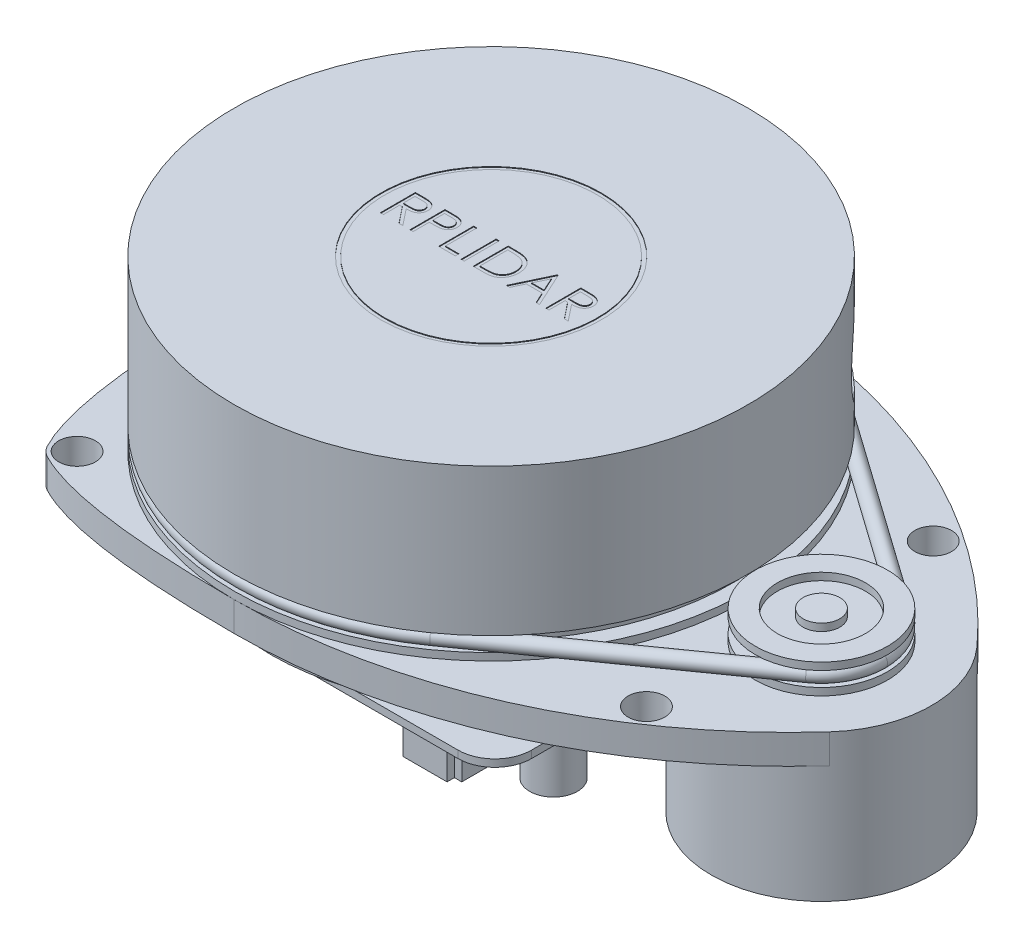
from build123d import *

# Parameters (mm, degrees)
SKETCH2_W            = 0.427404
SKETCH2_H            = 4.7625
CUT_EXTRUDE2_DEPTH   = 0.1
SKETCH4_R            = 1
SKETCH11_R           = 9
BOSS_EXTRUDE2_DEPTH  = 1
SKETCH12_R           = 7
BOSS_EXTRUDE3_DEPTH  = 2
SKETCH13_R           = 9
BOSS_EXTRUDE4_DEPTH  = 1
SKETCH14_R           = 6
SKETCH14_R_2         = 2.5
CUT_EXTRUDE3_DEPTH   = 1
SKETCH15_R           = 4
CUT_EXTRUDE4_DEPTH   = 69.337398
BOSS_EXTRUDE5_DEPTH  = 4
SKETCH18_R           = 15
BOSS_EXTRUDE7_DEPTH  = 16
BOSS_EXTRUDE11_DEPTH = 5
BOSS_EXTRUDE12_DEPTH = 1
FILLET1_R            = 3
SKETCH21_R           = 2.5
CUT_EXTRUDE6_DEPTH   = 10
SKETCH22_W           = 3.5
SKETCH22_H           = 8
SKETCH22_H_2         = 9
SKETCH22_H_3         = 10
BOSS_EXTRUDE13_DEPTH = 6.5
SKETCH23_R           = 3.25
BOSS_EXTRUDE14_DEPTH = 8
BOSS_EXTRUDE15_DEPTH = 4


with BuildPart() as part:
    # Sketch1 → Revolve2 (revolve)
    with BuildSketch(Plane.XY):
        Polygon((0, 0), (-35, 0), (-35, 1), (-33, 1), (-33, 3), (-35, 3), (-35, 23), (-15, 23), (-15, 22.9), (-14.5, 22.9), (-14.5, 23), (0, 23), align=None)
    revolve(axis=Axis((0, 67.529449, 0), (0, -1, 0)))

    # Sketch2 → Cut-Extrude2 (cut)
    # profile 1 of 7: a face of its own
    with BuildSketch(Plane(origin=(0, 23, 0), x_dir=(1, 0, 0), z_dir=(0, 1, 0))):
        with BuildLine():
            Line((-12.69453, 2.38125), (-11.741457, 2.38125))
            add(Edge.make_bspline(
                [(-11.741457, 2.38125), (-11.677856, 2.381038), (-11.555735, 2.380632), (-11.380783, 2.378365), (-11.221815, 2.371869), (-11.078913, 2.366278), (-10.95208, 2.356084), (-10.840927, 2.34634), (-10.745966, 2.333585), (-10.688481, 2.32174), (-10.662454, 2.316376)],
                knots=[0, 0, 0, 0, 1.410062, 2.707475, 3.878576, 4.937261, 5.877587, 6.699081, 7.410979, 8, 8, 8, 8], degree=3))
            add(Edge.make_bspline(
                [(-10.662454, 2.316376), (-10.62761, 2.307767), (-10.558667, 2.290733), (-10.459403, 2.254729), (-10.364814, 2.213065), (-10.275293, 2.164128), (-10.191288, 2.107557), (-10.111933, 2.044327), (-10.036869, 1.974785), (-9.96913, 1.897177), (-9.90526, 1.815756), (-9.851391, 1.727713), (-9.804954, 1.635645), (-9.767983, 1.538616), (-9.738213, 1.437567), (-9.717223, 1.331582), (-9.704634, 1.221145), (-9.703353, 1.145819), (-9.702703, 1.107625)],
                knots=[0, 0, 0, 0, 1.027469, 2.03302, 3.019913, 3.986114, 4.951241, 5.917227, 6.890402, 7.877631, 8.865154, 9.851037, 10.828763, 11.815025, 12.821071, 13.842952, 14.906261, 16, 16, 16, 16], degree=3))
            add(Edge.make_bspline(
                [(-9.702703, 1.107625), (-9.704702, 1.044168), (-9.708602, 0.920347), (-9.744967, 0.740649), (-9.804535, 0.573024), (-9.886618, 0.417681), (-9.991147, 0.277649), (-10.116775, 0.154654), (-10.263571, 0.051729), (-10.400226, -0.019644), (-10.520941, -0.065354), (-10.620318, -0.097517), (-10.728722, -0.122366), (-10.845114, -0.144627), (-10.969978, -0.161435), (-11.103015, -0.173744), (-11.24432, -0.181438), (-11.341392, -0.182584), (-11.39133, -0.183173)],
                knots=[0, 0, 0, 0, 1.260484, 2.45953, 3.627416, 4.787059, 5.93904, 7.088103, 8.267027, 9.491475, 10.141967, 10.831826, 11.566392, 12.351338, 13.187381, 14.070058, 15.00717, 16, 16, 16, 16], degree=3))
            Line((-11.39133, -0.183173), (-9.641645, -2.38125))
            Line((-9.641645, -2.38125), (-10.170176, -2.38125))
            Line((-10.170176, -2.38125), (-11.91986, -0.183173))
            Line((-11.91986, -0.183173), (-12.267126, -0.183173))
            Line((-12.267126, -0.183173), (-12.267126, -2.38125))
            Line((-12.267126, -2.38125), (-12.69453, -2.38125))
            Line((-12.69453, -2.38125), (-12.69453, 2.38125))
        make_face()
        with BuildLine():
            Line((-12.267126, 1.892788), (-12.267126, 0.305288))
            Line((-12.267126, 0.305288), (-11.395146, 0.29861))
            add(Edge.make_bspline(
                [(-11.395146, 0.29861), (-11.354433, 0.298592), (-11.275521, 0.298557), (-11.161356, 0.303992), (-11.055057, 0.310174), (-10.95703, 0.31963), (-10.867231, 0.331817), (-10.785706, 0.347061), (-10.712322, 0.364821), (-10.626735, 0.392309), (-10.531163, 0.435861), (-10.427297, 0.499223), (-10.338848, 0.578919), (-10.26412, 0.67005), (-10.204073, 0.770248), (-10.161738, 0.878311), (-10.134874, 0.991511), (-10.131706, 1.069314), (-10.130107, 1.108579)],
                knots=[0, 0, 0, 0, 1.14669, 2.222613, 3.218953, 4.145991, 4.996081, 5.770904, 6.481378, 7.121627, 8.300444, 9.431385, 10.535396, 11.636531, 12.74116, 13.810798, 14.89519, 16, 16, 16, 16], degree=3))
            add(Edge.make_bspline(
                [(-10.130107, 1.108579), (-10.131743, 1.146878), (-10.134984, 1.222774), (-10.161448, 1.333884), (-10.206201, 1.43875), (-10.266511, 1.536945), (-10.339989, 1.62608), (-10.426146, 1.702344), (-10.522628, 1.765276), (-10.612804, 1.805492), (-10.693405, 1.830147), (-10.763386, 1.847498), (-10.842459, 1.861438), (-10.931008, 1.872607), (-11.028655, 1.882207), (-11.135894, 1.888672), (-11.252013, 1.892501), (-11.332495, 1.89269), (-11.374157, 1.892788)],
                knots=[0, 0, 0, 0, 1.101029, 2.181837, 3.26431, 4.36902, 5.486613, 6.575447, 7.6667, 8.788928, 9.402425, 10.090347, 10.862061, 11.710949, 12.657783, 13.684531, 14.801375, 16, 16, 16, 16], degree=3))
            Line((-11.374157, 1.892788), (-12.267126, 1.892788))
        make_face(mode=Mode.SUBTRACT)
    # profile 2 of 7: a face of its own
    with BuildSketch(Plane(origin=(0, 23, 0), x_dir=(1, 0, 0), z_dir=(0, 1, 0))):
        with BuildLine():
            Line((-8.664722, 2.38125), (-7.73073, 2.38125))
            add(Edge.make_bspline(
                [(-7.73073, 2.38125), (-7.66649, 2.381179), (-7.543402, 2.381044), (-7.366897, 2.376942), (-7.206592, 2.371463), (-7.062832, 2.363867), (-6.935175, 2.354891), (-6.824198, 2.342302), (-6.729031, 2.329157), (-6.672008, 2.315793), (-6.646002, 2.309698)],
                knots=[0, 0, 0, 0, 1.415646, 2.712441, 3.890546, 4.950247, 5.884951, 6.70994, 7.411657, 8, 8, 8, 8], degree=3))
            add(Edge.make_bspline(
                [(-6.646002, 2.309698), (-6.613082, 2.300687), (-6.548017, 2.282879), (-6.454262, 2.247209), (-6.365062, 2.204915), (-6.28011, 2.156713), (-6.200451, 2.100536), (-6.124896, 2.038659), (-6.054112, 1.969655), (-5.988496, 1.894298), (-5.928237, 1.813852), (-5.876354, 1.727117), (-5.83291, 1.635553), (-5.795649, 1.539223), (-5.768832, 1.437319), (-5.748629, 1.330548), (-5.735806, 1.218922), (-5.734578, 1.142641), (-5.733953, 1.103809)],
                knots=[0, 0, 0, 0, 0.999701, 1.975846, 2.934578, 3.890452, 4.834028, 5.787355, 6.749477, 7.72691, 8.712836, 9.690892, 10.682876, 11.67975, 12.712815, 13.76553, 14.862518, 16, 16, 16, 16], degree=3))
            add(Edge.make_bspline(
                [(-5.733953, 1.103809), (-5.734526, 1.06465), (-5.735648, 0.988034), (-5.749114, 0.875949), (-5.767253, 0.768835), (-5.795144, 0.666932), (-5.831673, 0.570844), (-5.874525, 0.479103), (-5.926209, 0.39327), (-5.985597, 0.313032), (-6.051662, 0.238316), (-6.124124, 0.169661), (-6.202691, 0.107471), (-6.287113, 0.051605), (-6.378212, 0.003359), (-6.474608, -0.039854), (-6.577138, -0.076146), (-6.648089, -0.095236), (-6.684163, -0.104943)],
                knots=[0, 0, 0, 0, 1.121902, 2.195078, 3.232259, 4.234103, 5.217865, 6.176165, 7.13299, 8.084763, 9.034132, 9.988522, 10.942433, 11.903244, 12.886204, 13.894208, 14.929344, 16, 16, 16, 16], degree=3))
            add(Edge.make_bspline(
                [(-6.684163, -0.104943), (-6.714, -0.111288), (-6.779389, -0.125193), (-6.88708, -0.140717), (-7.012463, -0.153967), (-7.155369, -0.163902), (-7.315668, -0.172407), (-7.493447, -0.179167), (-7.689055, -0.182881), (-7.825495, -0.183073), (-7.896731, -0.183173)],
                knots=[0, 0, 0, 0, 0.601385, 1.31797, 2.144135, 3.087295, 4.142316, 5.309528, 6.595306, 8, 8, 8, 8], degree=3))
            Line((-7.896731, -0.183173), (-8.237318, -0.183173))
            Line((-8.237318, -0.183173), (-8.237318, -2.38125))
            Line((-8.237318, -2.38125), (-8.664722, -2.38125))
            Line((-8.664722, -2.38125), (-8.664722, 2.38125))
        make_face()
        with BuildLine():
            Line((-8.237318, 1.892788), (-8.237318, 0.305288))
            Line((-8.237318, 0.305288), (-7.403499, 0.294794))
            add(Edge.make_bspline(
                [(-7.403499, 0.294794), (-7.362787, 0.294773), (-7.284192, 0.294733), (-7.170659, 0.300155), (-7.065327, 0.306415), (-6.96852, 0.315581), (-6.880193, 0.328537), (-6.8002, 0.341615), (-6.729161, 0.360537), (-6.646023, 0.386013), (-6.553381, 0.429465), (-6.452596, 0.492534), (-6.367183, 0.572926), (-6.293271, 0.663315), (-6.234617, 0.76387), (-6.191678, 0.871461), (-6.166449, 0.984982), (-6.163066, 1.062663), (-6.161357, 1.101901)],
                knots=[0, 0, 0, 0, 1.160614, 2.240541, 3.239931, 4.169201, 5.011653, 5.785331, 6.478054, 7.106039, 8.262395, 9.384107, 10.481366, 11.590141, 12.703576, 13.786203, 14.881775, 16, 16, 16, 16], degree=3))
            add(Edge.make_bspline(
                [(-6.161357, 1.101901), (-6.163075, 1.140189), (-6.16649, 1.216302), (-6.191876, 1.327851), (-6.234533, 1.434308), (-6.293665, 1.533603), (-6.365431, 1.623667), (-6.448842, 1.701905), (-6.543701, 1.764799), (-6.631941, 1.805394), (-6.71032, 1.83018), (-6.778399, 1.847522), (-6.855267, 1.861368), (-6.940948, 1.872579), (-7.034779, 1.882177), (-7.137565, 1.888689), (-7.248917, 1.892501), (-7.32622, 1.89269), (-7.366292, 1.892788)],
                knots=[0, 0, 0, 0, 1.1207, 2.227813, 3.331159, 4.466774, 5.599789, 6.693662, 7.801753, 8.918577, 9.525283, 10.207425, 10.974604, 11.810963, 12.737642, 13.736265, 14.826524, 16, 16, 16, 16], degree=3))
            Line((-7.366292, 1.892788), (-8.237318, 1.892788))
        make_face(mode=Mode.SUBTRACT)
    # profile 3 of 7: a face of its own
    with BuildSketch(Plane(origin=(0, 23, 0), x_dir=(1, 0, 0), z_dir=(0, 1, 0))):
        Polygon((-4.75703, 2.38125), (-4.329626, 2.38125), (-4.329626, -1.892788), (-2.497895, -1.892788), (-2.497895, -2.38125), (-4.75703, -2.38125), align=None)
    # profile 4 of 7: a face of its own
    with BuildSketch(Plane(origin=(0, 23, 0), x_dir=(1, 0, 0), z_dir=(0, 1, 0))):
        with Locations((-1.490443, 0)):
            Rectangle(SKETCH2_W, SKETCH2_H)
    # profile 5 of 7: a face of its own
    with BuildSketch(Plane(origin=(0, 23, 0), x_dir=(1, 0, 0), z_dir=(0, 1, 0))):
        with BuildLine():
            Line((-0.055588, -2.38125), (-0.055588, 2.38125))
            Line((-0.055588, 2.38125), (0.906071, 2.38125))
            add(Edge.make_bspline(
                [(0.906071, 2.38125), (0.989713, 2.380648), (1.151308, 2.379484), (1.384824, 2.372107), (1.600883, 2.359057), (1.798776, 2.340049), (1.979045, 2.316709), (2.141185, 2.287453), (2.286036, 2.252907), (2.375122, 2.223453), (2.417249, 2.209525)],
                knots=[0, 0, 0, 0, 1.314314, 2.539247, 3.670749, 4.714932, 5.662651, 6.52616, 7.303039, 8, 8, 8, 8], degree=3))
            add(Edge.make_bspline(
                [(2.417249, 2.209525), (2.472351, 2.188528), (2.581305, 2.147011), (2.736436, 2.068693), (2.882475, 1.979957), (3.020205, 1.880685), (3.146481, 1.768066), (3.266234, 1.646885), (3.374567, 1.512734), (3.473775, 1.368397), (3.563222, 1.215572), (3.640972, 1.054552), (3.705543, 0.886154), (3.759146, 0.710846), (3.801392, 0.528243), (3.830214, 0.338132), (3.849225, 0.141265), (3.851135, 0.007678), (3.852105, -0.060104)],
                knots=[0, 0, 0, 0, 0.984719, 1.947109, 2.898478, 3.838006, 4.779231, 5.722359, 6.681677, 7.655905, 8.646513, 9.63752, 10.640069, 11.656949, 12.698409, 13.768548, 14.867775, 16, 16, 16, 16], degree=3))
            add(Edge.make_bspline(
                [(3.852105, -0.060104), (3.851249, -0.11897), (3.849562, -0.234972), (3.834419, -0.405933), (3.812407, -0.571823), (3.778329, -0.73185), (3.73696, -0.887419), (3.683941, -1.036869), (3.623205, -1.181572), (3.55238, -1.319573), (3.474627, -1.450315), (3.391185, -1.573562), (3.302145, -1.687556), (3.206656, -1.792642), (3.105952, -1.888662), (2.999375, -1.976417), (2.88665, -2.054191), (2.76828, -2.125039), (2.640814, -2.186843), (2.501836, -2.239136), (2.350754, -2.28247), (2.187939, -2.318625), (2.01311, -2.347305), (1.826095, -2.366527), (1.627181, -2.379526), (1.490594, -2.380664), (1.420291, -2.38125)],
                knots=[0, 0, 0, 0, 1.105936, 2.179363, 3.223086, 4.248585, 5.251746, 6.245859, 7.225917, 8.198733, 9.158002, 10.08287, 10.993791, 11.873724, 12.748671, 13.606409, 14.465104, 15.319839, 16.196478, 17.123217, 18.106603, 19.147569, 20.255747, 21.433718, 22.67912, 24, 24, 24, 24], degree=3))
            Line((1.420291, -2.38125), (-0.055588, -2.38125))
        make_face()
        with BuildLine():
            Line((0.371816, -1.892788), (0.918473, -1.892788))
            add(Edge.make_bspline(
                [(0.918473, -1.892788), (0.997025, -1.892451), (1.148109, -1.891802), (1.365358, -1.886104), (1.563858, -1.876794), (1.743638, -1.863765), (1.904595, -1.846527), (2.047067, -1.827307), (2.170586, -1.803362), (2.24533, -1.781657), (2.279869, -1.771627)],
                knots=[0, 0, 0, 0, 1.375205, 2.645023, 3.804391, 4.85397, 5.80019, 6.637939, 7.370583, 8, 8, 8, 8], degree=3))
            add(Edge.make_bspline(
                [(2.279869, -1.771627), (2.323342, -1.756317), (2.409249, -1.726062), (2.532912, -1.670875), (2.648242, -1.605503), (2.757249, -1.532838), (2.858386, -1.450316), (2.952852, -1.359732), (3.040458, -1.260625), (3.120297, -1.153117), (3.191745, -1.037879), (3.253619, -0.916042), (3.307845, -0.788942), (3.350407, -0.654627), (3.383765, -0.514298), (3.407394, -0.367945), (3.422109, -0.215595), (3.423826, -0.111973), (3.424701, -0.05915)],
                knots=[0, 0, 0, 0, 0.998632, 1.973412, 2.929993, 3.868528, 4.809262, 5.754881, 6.702106, 7.672491, 8.653609, 9.636854, 10.631411, 11.644892, 12.686317, 13.754757, 14.85543, 16, 16, 16, 16], degree=3))
            add(Edge.make_bspline(
                [(3.424701, -0.05915), (3.424002, -0.003451), (3.42263, 0.10597), (3.405384, 0.266521), (3.380182, 0.420936), (3.343737, 0.569224), (3.297294, 0.711675), (3.239335, 0.847501), (3.173114, 0.978136), (3.094324, 1.100566), (3.008033, 1.216353), (2.912269, 1.322428), (2.808553, 1.419031), (2.698015, 1.507667), (2.577542, 1.58477), (2.44997, 1.65374), (2.313428, 1.712272), (2.218433, 1.743404), (2.170156, 1.759225)],
                knots=[0, 0, 0, 0, 1.122419, 2.205002, 3.25162, 4.274785, 5.280384, 6.268708, 7.24935, 8.229343, 9.2, 10.157848, 11.105861, 12.055066, 13.010013, 13.985275, 14.976112, 16, 16, 16, 16], degree=3))
            add(Edge.make_bspline(
                [(2.170156, 1.759225), (2.130218, 1.770269), (2.045297, 1.793752), (1.906723, 1.819368), (1.750764, 1.841962), (1.576729, 1.861091), (1.384816, 1.874817), (1.174878, 1.885119), (0.946823, 1.892068), (0.788731, 1.892542), (0.70668, 1.892788)],
                knots=[0, 0, 0, 0, 0.674549, 1.434276, 2.29266, 3.240892, 4.284743, 5.425522, 6.663807, 8, 8, 8, 8], degree=3))
            Line((0.70668, 1.892788), (0.371816, 1.892788))
            Line((0.371816, 1.892788), (0.371816, -1.892788))
        make_face(mode=Mode.SUBTRACT)
    # profile 6 of 7: a face of its own
    with BuildSketch(Plane(origin=(0, 23, 0), x_dir=(1, 0, 0), z_dir=(0, 1, 0))):
        Polygon((6.782874, 2.38125), (8.980951, -2.38125), (8.51634, -2.38125), (7.812268, -0.854808), (5.653307, -0.854808), (4.930155, -2.38125), (4.462682, -2.38125), (6.721816, 2.38125), align=None)
        Polygon((6.747575, 1.452028), (5.886089, -0.366346), (7.587118, -0.366346), align=None, mode=Mode.SUBTRACT)
    # profile 7 of 7: a face of its own
    with BuildSketch(Plane(origin=(0, 23, 0), x_dir=(1, 0, 0), z_dir=(0, 1, 0))):
        with BuildLine():
            Line((9.835759, 2.38125), (10.788831, 2.38125))
            add(Edge.make_bspline(
                [(10.788831, 2.38125), (10.852432, 2.381038), (10.974554, 2.380632), (11.149505, 2.378365), (11.308474, 2.371869), (11.451376, 2.366278), (11.578209, 2.356084), (11.689362, 2.34634), (11.784323, 2.333585), (11.841807, 2.32174), (11.867835, 2.316376)],
                knots=[0, 0, 0, 0, 1.410062, 2.707475, 3.878576, 4.937261, 5.877587, 6.699081, 7.410979, 8, 8, 8, 8], degree=3))
            add(Edge.make_bspline(
                [(11.867835, 2.316376), (11.902678, 2.307767), (11.971621, 2.290733), (12.070886, 2.254729), (12.165475, 2.213065), (12.254996, 2.164128), (12.339001, 2.107557), (12.418355, 2.044327), (12.49342, 1.974785), (12.561158, 1.897177), (12.625029, 1.815756), (12.678898, 1.727713), (12.725334, 1.635645), (12.762305, 1.538616), (12.792075, 1.437567), (12.813066, 1.331582), (12.825654, 1.221145), (12.826936, 1.145819), (12.827585, 1.107625)],
                knots=[0, 0, 0, 0, 1.027469, 2.03302, 3.019913, 3.986114, 4.951241, 5.917227, 6.890402, 7.877631, 8.865154, 9.851037, 10.828763, 11.815025, 12.821071, 13.842952, 14.906261, 16, 16, 16, 16], degree=3))
            add(Edge.make_bspline(
                [(12.827585, 1.107625), (12.825587, 1.044168), (12.821686, 0.920347), (12.785321, 0.740649), (12.725754, 0.573024), (12.643671, 0.417681), (12.539142, 0.277649), (12.413514, 0.154654), (12.266718, 0.051729), (12.130062, -0.019644), (12.009348, -0.065354), (11.90997, -0.097517), (11.801566, -0.122366), (11.685174, -0.144627), (11.56031, -0.161435), (11.427273, -0.173744), (11.285968, -0.181438), (11.188896, -0.182584), (11.138959, -0.183173)],
                knots=[0, 0, 0, 0, 1.260484, 2.45953, 3.627416, 4.787059, 5.93904, 7.088103, 8.267027, 9.491475, 10.141967, 10.831826, 11.566392, 12.351338, 13.187381, 14.070058, 15.00717, 16, 16, 16, 16], degree=3))
            Line((11.138959, -0.183173), (12.888643, -2.38125))
            Line((12.888643, -2.38125), (12.360113, -2.38125))
            Line((12.360113, -2.38125), (10.610428, -0.183173))
            Line((10.610428, -0.183173), (10.263162, -0.183173))
            Line((10.263162, -0.183173), (10.263162, -2.38125))
            Line((10.263162, -2.38125), (9.835759, -2.38125))
            Line((9.835759, -2.38125), (9.835759, 2.38125))
        make_face()
        with BuildLine():
            Line((10.263162, 1.892788), (10.263162, 0.305288))
            Line((10.263162, 0.305288), (11.135143, 0.29861))
            add(Edge.make_bspline(
                [(11.135143, 0.29861), (11.175855, 0.298592), (11.254768, 0.298557), (11.368933, 0.303992), (11.475232, 0.310174), (11.573259, 0.31963), (11.663057, 0.331817), (11.744582, 0.347061), (11.817967, 0.364821), (11.903554, 0.392309), (11.999126, 0.435861), (12.102991, 0.499223), (12.191441, 0.578919), (12.266168, 0.67005), (12.326216, 0.770248), (12.36855, 0.878311), (12.395414, 0.991511), (12.398583, 1.069314), (12.400182, 1.108579)],
                knots=[0, 0, 0, 0, 1.14669, 2.222613, 3.218953, 4.145991, 4.996081, 5.770904, 6.481378, 7.121627, 8.300444, 9.431385, 10.535396, 11.636531, 12.74116, 13.810798, 14.89519, 16, 16, 16, 16], degree=3))
            add(Edge.make_bspline(
                [(12.400182, 1.108579), (12.398546, 1.146878), (12.395304, 1.222774), (12.36884, 1.333884), (12.324087, 1.43875), (12.263777, 1.536945), (12.1903, 1.62608), (12.104142, 1.702344), (12.007661, 1.765276), (11.917485, 1.805492), (11.836884, 1.830147), (11.766903, 1.847498), (11.687829, 1.861438), (11.59928, 1.872607), (11.501633, 1.882207), (11.394395, 1.888672), (11.278276, 1.892501), (11.197793, 1.89269), (11.156131, 1.892788)],
                knots=[0, 0, 0, 0, 1.101029, 2.181837, 3.26431, 4.36902, 5.486613, 6.575447, 7.6667, 8.788928, 9.402425, 10.090347, 10.862061, 11.710949, 12.657783, 13.684531, 14.801375, 16, 16, 16, 16], degree=3))
            Line((11.156131, 1.892788), (10.263162, 1.892788))
        make_face(mode=Mode.SUBTRACT)
    extrude(amount=-CUT_EXTRUDE2_DEPTH, mode=Mode.SUBTRACT)

    # Sketch15 → Cut-Extrude4 (cut, through all)
    with BuildSketch(Plane.XY):
        with Locations((-20, 12)):
            Circle(SKETCH15_R)
        with BuildLine():
            Line((13, 17), (26, 17))
            ThreePointArc((26, 17), (27.70061, 12), (26, 7))
            Line((26, 7), (13, 7))
            ThreePointArc((13, 7), (11.29939, 12), (13, 17))
        make_face()
    extrude(amount=-CUT_EXTRUDE4_DEPTH, mode=Mode.SUBTRACT)



with BuildPart() as body_2:
    # Sweep1: sweep along a path in Sketch3
    with BuildLine(Plane(origin=(0, 1, 0), x_dir=(1, 0, 0), z_dir=(0, 1, 0))) as sweep1_path:
        Line((20.222222, 28.566794), (50.2, 7.345747))
        ThreePointArc((50.2, 7.345747), (54, 0), (50.2, -7.345747))
        Line((50.2, -7.345747), (20.222222, -28.566794))
        ThreePointArc((20.222222, -28.566794), (-35, 0), (20.222222, 28.566794))
    # Sketch4 → Sweep1 (sweep)
    with BuildSketch(Plane.XY):
        with Locations((53, 2)):
            Circle(SKETCH4_R)
    sweep(path=sweep1_path.line)


with BuildPart() as body_3:
    # Sketch11 → Boss-Extrude2 (new body)
    with BuildSketch(Plane(origin=(0, 0, 0), x_dir=(1, 0, 0), z_dir=(0, 1, 0))):
        with Locations((45, 0)):
            Circle(SKETCH11_R)
    extrude(amount=BOSS_EXTRUDE2_DEPTH)

    # Sketch12 → Boss-Extrude3 (add)
    with BuildSketch(Plane(origin=(0, 1, 0), x_dir=(1, 0, 0), z_dir=(0, 1, 0))):
        with Locations((45, 0)):
            Circle(SKETCH12_R)
    extrude(amount=BOSS_EXTRUDE3_DEPTH)

    # Sketch13 → Boss-Extrude4 (add)
    with BuildSketch(Plane(origin=(0, 3, 0), x_dir=(1, 0, 0), z_dir=(0, 1, 0))):
        with Locations((45, 0)):
            Circle(SKETCH13_R)
    extrude(amount=BOSS_EXTRUDE4_DEPTH)

    # Sketch14 → Cut-Extrude3 (cut)
    with BuildSketch(Plane(origin=(0, 4, 0), x_dir=(1, 0, 0), z_dir=(0, 1, 0))):
        with Locations((45, 0)):
            Circle(SKETCH14_R)
        with Locations((45, 0)):
            Circle(SKETCH14_R_2, mode=Mode.SUBTRACT)
    extrude(amount=-CUT_EXTRUDE3_DEPTH, mode=Mode.SUBTRACT)


with BuildPart() as part_1:
    add(part.part)

    add(body_3.part)  # Boss-Extrude5 merges body 3
    # Sketch16 → Boss-Extrude5 (add)
    with BuildSketch(Plane.XZ):
        with BuildLine():
            ThreePointArc((0, 35), (30.714221, 28.481998), (56.134021, 10.051546))
            ThreePointArc((56.134021, 10.051546), (60, 0), (56.134021, -10.051546))
            ThreePointArc((56.134021, -10.051546), (30.714221, -28.481998), (0, -35))
            add(Edge.make_bspline(
                [(-30.405592, -30.405592), (-22.727244, -35), (0, -35)],
                knots=[0, 0, 0, 0.299273, 0.299273, 0.299273], degree=2))
            add(Edge.make_bspline(
                [(-30.405592, -30.405592), (-35, -22.727244), (-35, 0)],
                knots=[0, 0, 0, 0.299273, 0.299273, 0.299273], degree=2))
            add(Edge.make_bspline(
                [(-30.405592, 30.405592), (-35, 22.727244), (-35, 0)],
                knots=[0, 0, 0, 0.299273, 0.299273, 0.299273], degree=2))
            add(Edge.make_bspline(
                [(-30.405592, 30.405592), (-22.727244, 35), (0, 35)],
                knots=[0, 0, 0, 0.299273, 0.299273, 0.299273], degree=2))
        make_face()
    extrude(amount=BOSS_EXTRUDE5_DEPTH)

    # Sketch18 → Boss-Extrude7 (add)
    with BuildSketch(Plane.XZ.offset(4)):
        with Locations((45, 0)):
            Circle(SKETCH18_R)
    extrude(amount=BOSS_EXTRUDE7_DEPTH)

    # Sketch19 → Boss-Extrude11 (add)
    with BuildSketch(Plane.XZ.offset(4)):
        with BuildLine():
            ThreePointArc((29.830556, 3.184016), (-30, 0), (29.830556, -3.184016))
            ThreePointArc((29.830556, -3.184016), (29.5, 0), (29.830556, 3.184016))
        make_face()
    extrude(amount=BOSS_EXTRUDE11_DEPTH)

    # Sketch20 → Boss-Extrude12 (add)
    with BuildSketch(Plane.XZ.offset(9)):
        with BuildLine():
            Line((29, 23.5), (29, -23.5))
            ThreePointArc((29, -23.5), (27.535534, -27.035534), (24, -28.5))
            Line((24, -28.5), (-12, -28.5))
            ThreePointArc((-12, -28.5), (-15.535534, -27.035534), (-17, -23.5))
            Line((-17, -23.5), (-17, 23.5))
            ThreePointArc((-17, 23.5), (-15.535534, 27.035534), (-12, 28.5))
            Line((-12, 28.5), (24, 28.5))
            ThreePointArc((24, 28.5), (27.535534, 27.035534), (29, 23.5))
        make_face()
    extrude(amount=BOSS_EXTRUDE12_DEPTH)

    # Fillet1
    fillet1_edges = [part_1.edges().sort_by_distance(p)[0] for p in [
        (-30.405592, -2, 30.405592),
        (-30.405592, -2, -30.405592),
    ]]
    fillet(fillet1_edges, radius=FILLET1_R)

    # Sketch21 → Cut-Extrude6 (cut)
    with BuildSketch(Plane(origin=(0, 0, 0), x_dir=(1, 0, 0), z_dir=(0, 1, 0))):
        with Locations((-28.200125, 28.200125)):
            Circle(SKETCH21_R)
        with Locations((40.690753, 19.530243)):
            Circle(SKETCH21_R)
        with Locations((-28.200125, -28.200125)):
            Circle(SKETCH21_R)
        with Locations((40.690753, -19.530243)):
            Circle(SKETCH21_R)
    extrude(amount=-CUT_EXTRUDE6_DEPTH, mode=Mode.SUBTRACT)

    # Sketch22 → Boss-Extrude13 (add)
    with BuildSketch(Plane.XZ.offset(10)):
        with Locations((24.75, -18.5)):
            Rectangle(SKETCH22_W, SKETCH22_H)
        with Locations((24.75, -8)):
            Rectangle(SKETCH22_W, SKETCH22_H_2)
        with Locations((24.75, 3.5)):
            Rectangle(SKETCH22_W, SKETCH22_H_3)
    extrude(amount=BOSS_EXTRUDE13_DEPTH)

    # Sketch23 → Boss-Extrude14 (add)
    with BuildSketch(Plane.XZ.offset(10)):
        with Locations((24.75, 16.25)):
            Circle(SKETCH23_R)
    extrude(amount=BOSS_EXTRUDE14_DEPTH)

    # Sketch24 → Boss-Extrude15 (add)
    with BuildSketch(Plane.XZ.offset(10)):
        Polygon((16, 27), (16, 28), (22, 28), (22, 27), (23, 27), (23, 21), (22, 21), (22, 20), (16, 20), (16, 21), (15, 21), (15, 27), align=None)
    extrude(amount=BOSS_EXTRUDE15_DEPTH)


solid = Compound([body_2.part, part_1.part])
